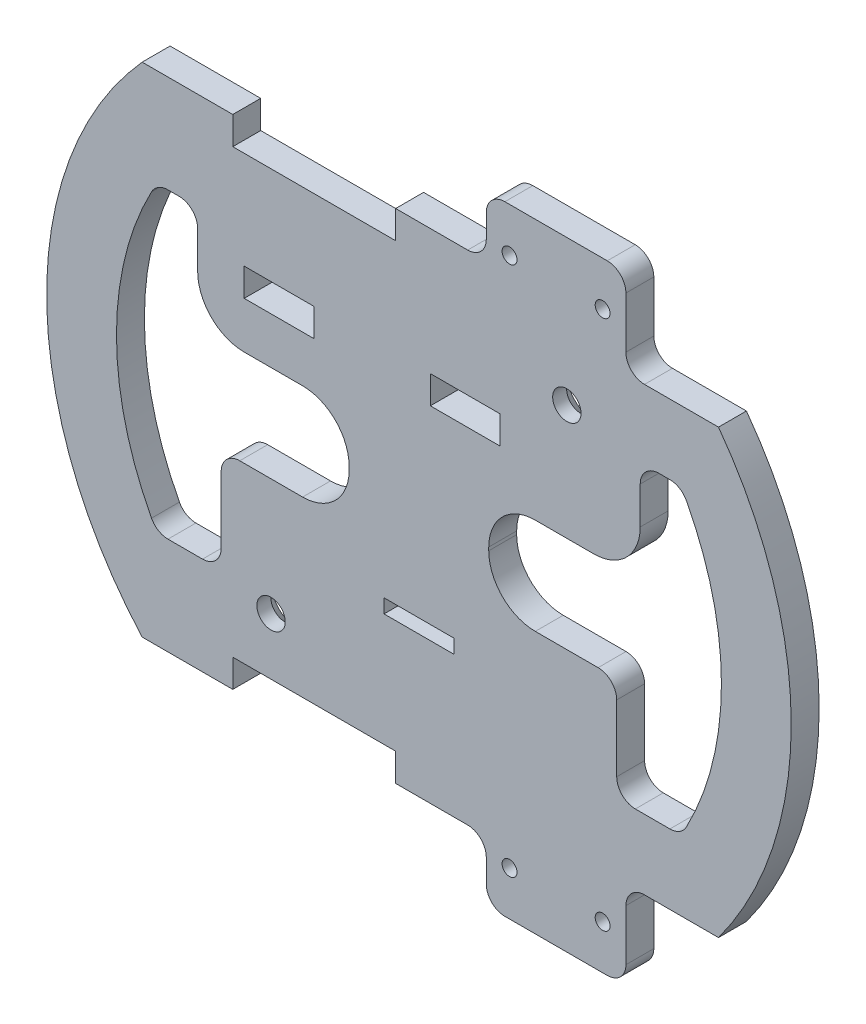
from build123d import *

# Parameters (mm, degrees)
ESBO_O1_R                = 3.05
ESBO_O1_W                = 15
ESBO_O1_H                = 3
ESBO_O1_R_2              = 1.6
ESBO_O1_H_2              = 6
RESSALTO_EXTRUS_O1_DEPTH = 6
CHANFRO1_SIZE            = 3
FILETE1_R                = 4
FILETE2_R                = 10


with BuildPart() as part:
    # Esboço1 → Ressalto-extrusão1 (new body)
    with BuildSketch(Plane.XY):
        with BuildLine():
            Line((14.471901241, -53.5), (14.471901241, -66.5))
            Line((14.471901241, -66.5), (44.471901241, -66.5))
            Line((44.471901241, -66.5), (44.471901241, -47.5))
            Line((44.471901241, -47.5), (64.371965948, -47.5))
            ThreePointArc((64.371965948, -47.5), (75.99262226, -25.002427124), (80, 0))
            ThreePointArc((80, 0), (75.99262226, 25.002427124), (64.371965948, 47.5))
            Line((64.371965948, 47.5), (44.471901241, 47.5))
            Line((44.471901241, 47.5), (44.471901241, 66.5))
            Line((44.471901241, 66.5), (14.471901241, 66.5))
            Line((14.471901241, 66.5), (14.471901241, 53.5))
            Line((14.471901241, 53.5), (-5.003543323, 53.5))
            Line((-5.003543323, 53.5), (-5.003543323, 47.5))
            Line((-5.003543323, 47.5), (-40.003543323, 47.5))
            Line((-40.003543323, 47.5), (-40.003543323, 53.5))
            Line((-40.003543323, 53.5), (-59.478987886, 53.5))
            ThreePointArc((-59.478987886, 53.5), (-74.693771597, 28.650313865), (-80, 0))
            ThreePointArc((-80, 0), (-74.693771597, -28.650313865), (-59.478987886, -53.5))
            Line((-59.478987886, -53.5), (-40.003543323, -53.5))
            Line((-40.003543323, -53.5), (-40.003543323, -47.5))
            Line((-40.003543323, -47.5), (-5.003543323, -47.5))
            Line((-5.003543323, -47.5), (-5.003543323, -53.5))
            Line((-5.003543323, -53.5), (14.471901241, -53.5))
        make_face()
        with BuildLine():
            ThreePointArc((-56.291651246, -32.5), (-65, 0), (-56.291651246, 32.5))
            Line((-56.291651246, 32.5), (-47.55, 32.5))
            Line((-47.55, 32.5), (-47.55, 10.5))
            Line((-47.55, 10.5), (-15, 10.5))
            Line((-15, 10.5), (-15, -10.2))
            Line((-15, -10.2), (-42.5, -10.2))
            Line((-42.5, -10.2), (-42.5, -32.5))
            Line((-42.5, -32.5), (-56.291651246, -32.5))
        make_face(mode=Mode.SUBTRACT)
        with Locations((-31.783703802, -35.29937921)):
            Circle(ESBO_O1_R, mode=Mode.SUBTRACT)
        with Locations((0, -21.7)):
            Rectangle(ESBO_O1_W, ESBO_O1_H, mode=Mode.SUBTRACT)
        with Locations((19.471901241, -57)):
            Circle(ESBO_O1_R_2, mode=Mode.SUBTRACT)
        with Locations((39.471901241, -57)):
            Circle(ESBO_O1_R_2, mode=Mode.SUBTRACT)
        with BuildLine():
            Line((42.5, -10.2), (15, -10.2))
            Line((15, -10.2), (15, 10.5))
            Line((15, 10.5), (47.55, 10.5))
            Line((47.55, 10.5), (47.55, 32.5))
            Line((47.55, 32.5), (56.291651246, 32.5))
            ThreePointArc((56.291651246, 32.5), (65, 0), (56.291651246, -32.5))
            Line((56.291651246, -32.5), (42.5, -32.5))
            Line((42.5, -32.5), (42.5, -10.2))
        make_face(mode=Mode.SUBTRACT)
        with Locations((-30.05, 23.5)):
            Rectangle(ESBO_O1_W, ESBO_O1_H_2, mode=Mode.SUBTRACT)
        with Locations((9.95, 23.5)):
            Rectangle(ESBO_O1_W, ESBO_O1_H_2, mode=Mode.SUBTRACT)
        with Locations((31.783703802, 35.29937921)):
            Circle(ESBO_O1_R, mode=Mode.SUBTRACT)
        with Locations((19.471901241, 57)):
            Circle(ESBO_O1_R_2, mode=Mode.SUBTRACT)
        with Locations((39.471901241, 57)):
            Circle(ESBO_O1_R_2, mode=Mode.SUBTRACT)
    extrude(amount=RESSALTO_EXTRUS_O1_DEPTH)

    # Chanfro1
    chanfro1_edges = [part.edges().sort_by_distance(p)[0] for p in [
        (28.733703802, 35.29937921, 0),
        (-34.833703802, -35.29937921, 0),
    ]]
    chamfer(chanfro1_edges, length=CHANFRO1_SIZE)

    # Filete1
    filete1_edges = [part.edges().sort_by_distance(p)[0] for p in [
        (56.291651246, 32.5, 3),
        (47.55, 32.5, 3),
        (42.5, -32.5, 3),
        (56.291651246, -32.5, 3),
        (-42.5, -32.5, 3),
        (-56.291651246, -32.5, 3),
        (42.5, -10.2, 3),
        (-42.5, -10.2, 3),
        (-47.55, 32.5, 3),
        (-56.291651246, 32.5, 3),
        (14.471901241, -53.5, 3),
        (14.471901241, 53.5, 3),
        (44.471901241, 47.5, 3),
        (44.471901241, -47.5, 3),
        (14.471901241, 66.5, 3),
        (44.471901241, 66.5, 3),
        (44.471901241, -66.5, 3),
        (14.471901241, -66.5, 3),
    ]]
    fillet(filete1_edges, radius=FILETE1_R)

    # Filete2
    filete2_edges = [part.edges().sort_by_distance(p)[0] for p in [
        (15, -10.2, 3),
        (-15, -10.2, 3),
        (-15, 10.5, 3),
        (15, 10.5, 3),
        (47.55, 10.5, 3),
        (-47.55, 10.5, 3),
    ]]
    fillet(filete2_edges, radius=FILETE2_R)


solid = part.part
